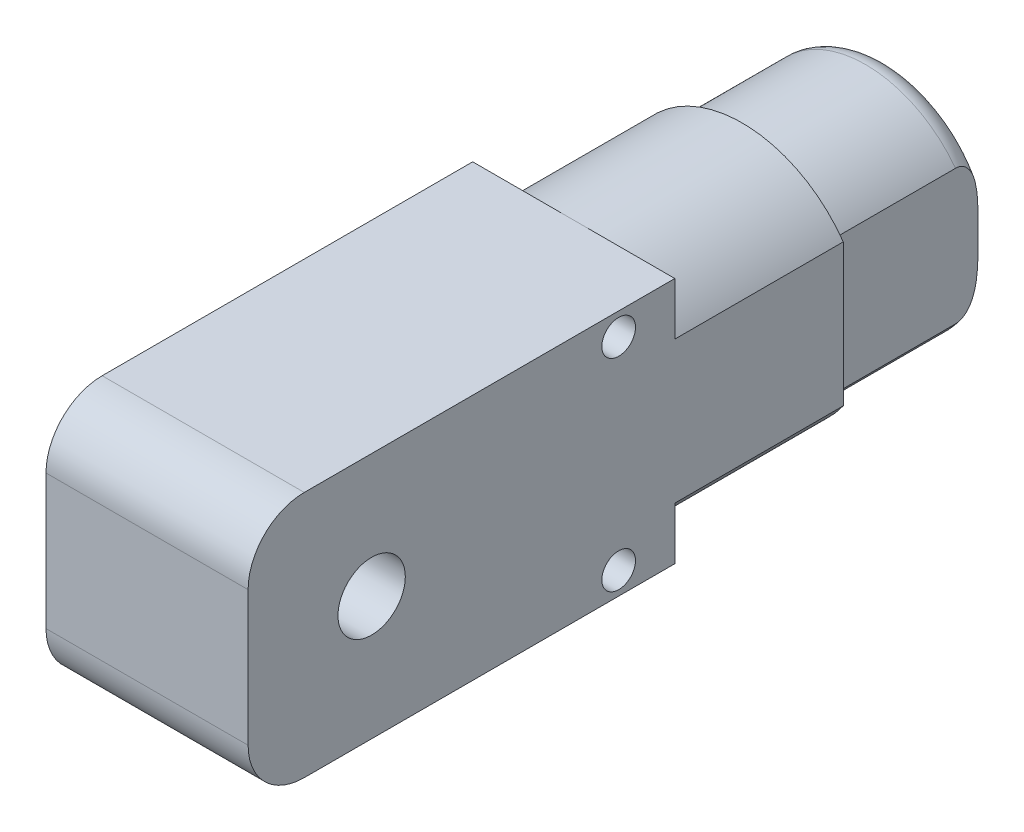
from build123d import *

# Parameters (mm, degrees)
SKETCH1_W           = 38
SKETCH1_H           = 22
BOSS_EXTRUDE1_DEPTH = 18
FILLET1_R           = 5
BOSS_EXTRUDE2_DEPTH = 15
BOSS_EXTRUDE3_DEPTH = 13
FILLET2_R           = 2
SKETCH5_R           = 3
SKETCH5_R_2         = 1.5
CUT_EXTRUDE1_DEPTH  = 52.516987581


with BuildPart() as part:
    # Sketch1 → Boss-Extrude1 (new body)
    with BuildSketch(Plane(origin=(0, 0, 0), x_dir=(0, 0, -1), z_dir=(1, 0, 0))):
        Rectangle(SKETCH1_W, SKETCH1_H)
    extrude(amount=BOSS_EXTRUDE1_DEPTH)

    # Fillet1
    fillet1_edges = [part.edges().sort_by_distance(p)[0] for p in [
        (9, 11, 19),
        (9, -11, 19),
    ]]
    fillet(fillet1_edges, radius=FILLET1_R)

    # Sketch3 → Boss-Extrude2 (add)
    with BuildSketch(Plane(origin=(0, 0, -19), x_dir=(-1, 0, 0), z_dir=(0, 0, -1))):
        with BuildLine():
            Line((-18, 6.32455532), (-18, -6.32455532))
            ThreePointArc((-18, -6.32455532), (-9, -11), (0, -6.32455532))
            Line((0, -6.32455532), (0, 6.32455532))
            ThreePointArc((0, 6.32455532), (-9, 11), (-18, 6.32455532))
        make_face()
    extrude(amount=BOSS_EXTRUDE2_DEPTH)

    # Sketch4 → Boss-Extrude3 (add)
    with BuildSketch(Plane(origin=(0, 0, -34), x_dir=(-1, 0, 0), z_dir=(0, 0, -1))):
        with BuildLine():
            Line((-17, 6), (-17, -6))
            ThreePointArc((-17, -6), (-9, -10), (-1, -6))
            Line((-1, -6), (-1, 6))
            ThreePointArc((-1, 6), (-9, 10), (-17, 6))
        make_face()
    extrude(amount=BOSS_EXTRUDE3_DEPTH)

    # Fillet2
    fillet2_edges = [part.edges().sort_by_distance(p)[0] for p in [
        (9, 10, -47),
        (9, -10, -47),
    ]]
    fillet(fillet2_edges, radius=FILLET2_R - 0.0001)  # a hair under: the kernel refuses the full size

    # Sketch5 → Cut-Extrude1 (cut, through all)
    with BuildSketch(Plane(origin=(18, 0, 0), x_dir=(0, 0, -1), z_dir=(1, 0, 0))):
        with Locations((-8, 0)):
            Circle(SKETCH5_R)
        with Locations((14, -9)):
            Circle(SKETCH5_R_2)
        with Locations(Location((14, 9, 0), (0, 0, 180))):
            Circle(SKETCH5_R_2)
    extrude(amount=-CUT_EXTRUDE1_DEPTH, mode=Mode.SUBTRACT)


solid = part.part
